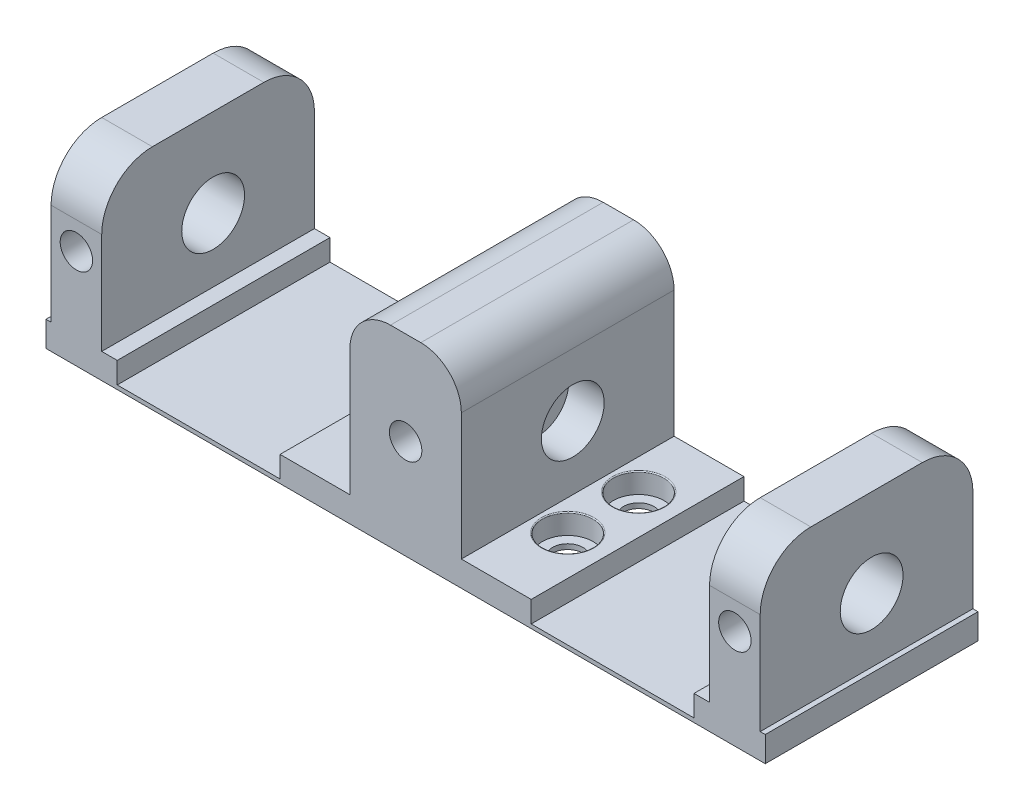
from build123d import *

# Parameters (mm, degrees)
SALIENTE_EXTRUIR1_DEPTH      = 10
SALIENTE_EXTRUIR1_DEPTH_BACK = 11
CROQUIS2_R                   = 3.1
CORTAR_EXTRUIR1_DEPTH        = 3.5
CORTAR_EXTRUIR2_START        = -3.5
CROQUIS3_R                   = 3.1
CORTAR_EXTRUIR2_DEPTH        = 3.5
CROQUIS4_R                   = 2.5
CORTAR_EXTRUIR3_DEPTH        = 2
REDONDEO1_R                  = 0.1
CROQUIS5_R                   = 1.5
CORTAR_EXTRUIR4_DEPTH        = 23.923786773
CROQUIS6_W                   = 21
CROQUIS6_H                   = 2.5
SALIENTE_EXTRUIR2_DEPTH      = 24
CROQUIS7_W                   = 21
CROQUIS7_H                   = 2.5
SALIENTE_EXTRUIR3_DEPTH      = 24
CROQUIS8_W                   = 5
CROQUIS8_H                   = 21
SALIENTE_EXTRUIR4_DEPTH      = 15
REDONDEO4_R                  = 5
REDONDEO5_R                  = 5
CROQUIS34_W                  = 16.071632226
CROQUIS34_H                  = 2.1
CORTAR_EXTRUIR7_DEPTH        = 43.32611487
CORTAR_EXTRUIR8_START        = -2.2
CROQUIS35_R                  = 1.5
CORTAR_EXTRUIR8_DEPTH        = 2.2
CROQUIS36_R                  = 1.6
CORTAR_EXTRUIR9_DEPTH        = 4.5
CROQUIS37_R                  = 3.1
CORTAR_EXTRUIR10_DEPTH       = 7
CORTAR_EXTRUIR11_START       = -7
CROQUIS38_R                  = 3.1
CORTAR_EXTRUIR11_DEPTH       = 7


with BuildPart() as part:
    # Croquis1 → Saliente-Extruir1 (new, two sides: drawn at the far end of the back side and taken through both)
    with BuildSketch(Plane.XY.offset(-SALIENTE_EXTRUIR1_DEPTH_BACK)):
        with BuildLine():
            Line((-1.5, 9.5), (1.5, 9.5))
            ThreePointArc((1.5, 9.5), (4.328427125, 8.328427125), (5.5, 5.5))
            Line((5.5, 5.5), (5.5, -7))
            Line((5.5, -7), (11.5, -7))
            Line((11.5, -7), (11.5, -9.5))
            Line((11.5, -9.5), (5.5, -9.5))
            Line((5.5, -9.5), (-5.5, -9.5))
            Line((-5.5, -9.5), (-11.5, -9.5))
            Line((-11.5, -9.5), (-11.5, -7))
            Line((-11.5, -7), (-5.5, -7))
            Line((-5.5, -7), (-5.5, 5.5))
            ThreePointArc((-5.5, 5.5), (-4.328427125, 8.328427125), (-1.5, 9.5))
        make_face()
    extrude(amount=SALIENTE_EXTRUIR1_DEPTH + SALIENTE_EXTRUIR1_DEPTH_BACK)

    # Croquis2 → Cortar-Extruir1 (cut)
    with BuildSketch(Plane(origin=(5.5, 0, 0), x_dir=(0, 0, -1), z_dir=(1, 0, 0))):
        with Locations((1, -0.68)):
            Circle(CROQUIS2_R)
    extrude(amount=-CORTAR_EXTRUIR1_DEPTH, mode=Mode.SUBTRACT)

    # Croquis3 → Cortar-Extruir2 (cut)
    with BuildSketch(Plane.ZY.offset(5.5).offset(CORTAR_EXTRUIR2_START)):
        with Locations((-1, -0.68)):
            Circle(CROQUIS3_R)
    extrude(amount=CORTAR_EXTRUIR2_DEPTH, mode=Mode.SUBTRACT)

    # Croquis4 → Cortar-Extruir3 (cut)
    with BuildSketch(Plane(origin=(0, -7, 0), x_dir=(1, 0, 0), z_dir=(0, 1, 0))):
        with Locations((-8.5, 4.5)):
            Circle(CROQUIS4_R)
        with Locations((-8.5, -2.5)):
            Circle(CROQUIS4_R)
        with Locations((8.5, -2.5)):
            Circle(CROQUIS4_R)
        with Locations((8.5, 4.5)):
            Circle(CROQUIS4_R)
    extrude(amount=-CORTAR_EXTRUIR3_DEPTH, mode=Mode.SUBTRACT)

    # Redondeo1
    redondeo1_edges = [part.edges().sort_by_distance(p)[0] for p in [
        (6, -7, 2.5),
        (6, -7, -4.5),
        (-11, -7, 2.5),
        (-11, -7, -4.5),
    ]]
    fillet(redondeo1_edges, radius=REDONDEO1_R)

    # Croquis5 → Cortar-Extruir4 (cut, through all)
    with BuildSketch(Plane(origin=(0, -7, 0), x_dir=(1, 0, 0), z_dir=(0, 1, 0))):
        with Locations((-8.5, 4.5)):
            Circle(CROQUIS5_R)
        with Locations((-8.5, -2.5)):
            Circle(CROQUIS5_R)
        with Locations((8.5, -2.5)):
            Circle(CROQUIS5_R)
        with Locations((8.5, 4.5)):
            Circle(CROQUIS5_R)
    extrude(amount=-CORTAR_EXTRUIR4_DEPTH, mode=Mode.SUBTRACT)

    # Croquis6 → Saliente-Extruir2 (add)
    with BuildSketch(Plane.ZY.offset(11.5)):
        with Locations((-0.5, -8.25)):
            Rectangle(CROQUIS6_W, CROQUIS6_H)
    extrude(amount=SALIENTE_EXTRUIR2_DEPTH)

    # Croquis7 → Saliente-Extruir3 (add)
    with BuildSketch(Plane(origin=(11.5, 0, 0), x_dir=(0, 0, -1), z_dir=(1, 0, 0))):
        with Locations((0.5, -8.25)):
            Rectangle(CROQUIS7_W, CROQUIS7_H)
    extrude(amount=SALIENTE_EXTRUIR3_DEPTH)

    # Croquis8 → Saliente-Extruir4 (add)
    with BuildSketch(Plane(origin=(0, -7, 0), x_dir=(1, 0, 0), z_dir=(0, 1, 0))):
        with Locations((-32.5, 0.5)):
            Rectangle(CROQUIS8_W, CROQUIS8_H)
        with Locations((32.5, 0.5)):
            Rectangle(CROQUIS8_W, CROQUIS8_H)
    extrude(amount=SALIENTE_EXTRUIR4_DEPTH)

    # Redondeo4
    redondeo4_edges = [part.edges().sort_by_distance(p)[0] for p in [
        (-32.5, 8, -11),
        (-32.5, 8, 10),
    ]]
    fillet(redondeo4_edges, radius=REDONDEO4_R)

    # Redondeo5
    redondeo5_edges = [part.edges().sort_by_distance(p)[0] for p in [
        (32.5, 8, -11),
        (32.5, 8, 10),
    ]]
    fillet(redondeo5_edges, radius=REDONDEO5_R)

    # Croquis34 → Cortar-Extruir7 (cut, through all)
    with BuildSketch(Plane.XY.offset(10)):
        with Locations((-20.432461487, -8.05)):
            Rectangle(CROQUIS34_W, CROQUIS34_H)
        with Locations((20.432461487, -8.05)):
            Rectangle(CROQUIS34_W, CROQUIS34_H)
    extrude(amount=-CORTAR_EXTRUIR7_DEPTH, mode=Mode.SUBTRACT)

    # Croquis35 → Cortar-Extruir8 (cut)
    with BuildSketch(Plane.XZ.offset(9.5).offset(CORTAR_EXTRUIR8_START)):
        with Locations((-31, 2.5)):
            Circle(CROQUIS35_R)
        with Locations((-31, -4.5)):
            Circle(CROQUIS35_R)
        with Locations((31, -4.5)):
            Circle(CROQUIS35_R)
        with Locations((31, 2.5)):
            Circle(CROQUIS35_R)
        with Locations((-8.5, 2.5)):
            Circle(CROQUIS35_R)
    extrude(amount=CORTAR_EXTRUIR8_DEPTH, mode=Mode.SUBTRACT)

    # Croquis36 → Cortar-Extruir9 (cut)
    with BuildSketch(Plane.XY.offset(10)):
        with Locations((-32.5, 0.312555563)):
            Circle(CROQUIS36_R)
        with Locations((32.5, 0.312555563)):
            Circle(CROQUIS36_R)
        with Locations((0, 0.312555563)):
            Circle(CROQUIS36_R)
    extrude(amount=-CORTAR_EXTRUIR9_DEPTH, mode=Mode.SUBTRACT)

    # Croquis37 → Cortar-Extruir10 (cut)
    with BuildSketch(Plane(origin=(35, 0, 0), x_dir=(0, 0, -1), z_dir=(1, 0, 0))):
        with Locations((1, -0.68)):
            Circle(CROQUIS37_R)
    extrude(amount=-CORTAR_EXTRUIR10_DEPTH, mode=Mode.SUBTRACT)

    # Croquis38 → Cortar-Extruir11 (cut)
    with BuildSketch(Plane.ZY.offset(35).offset(CORTAR_EXTRUIR11_START)):
        with Locations((-1, -0.68)):
            Circle(CROQUIS38_R)
    extrude(amount=CORTAR_EXTRUIR11_DEPTH, mode=Mode.SUBTRACT)


solid = part.part
